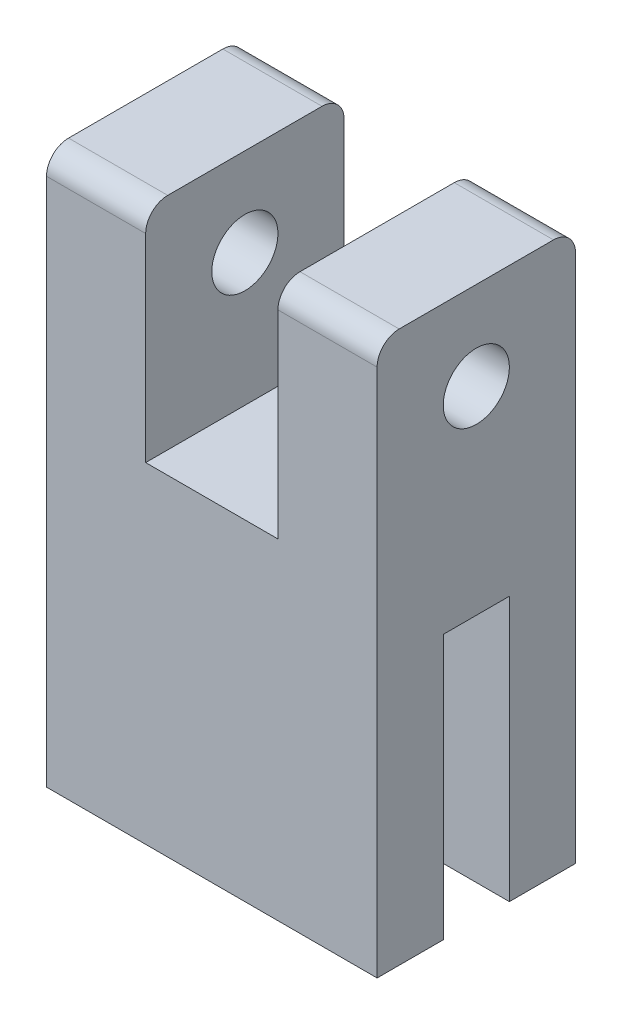
from build123d import *

# Parameters (mm, degrees)
CROQUIS2_W                 = 15
CROQUIS2_H                 = 15
SALIENTE_EXTRUIR1_DEPTH    = 4.5
CROQUIS3_W                 = 15
CROQUIS3_H                 = 12
CORTAR_EXTRUIR1_DEPTH      = 1.5
CORTAR_EXTRUIR2_DEPTH      = 12.521718622
CROQUIS10_W                = 4.5
CROQUIS10_H                = 9
SALIENTE_EXTRUIR4_DEPTH    = 10
CORTAR_EXTRUIR3_DEPTH      = 20.563997547
CORTAR_EXTRUIR3_DEPTH_BACK = 20.563997547
CROQUIS7_R                 = 1.5
REDONDEO2_R                = 1


with BuildPart() as part:
    # Croquis2 → Saliente-Extruir1 (new, symmetric)
    with BuildSketch(Plane.XY):
        Rectangle(CROQUIS2_W, CROQUIS2_H)
    extrude(amount=SALIENTE_EXTRUIR1_DEPTH, both=True)

    # Croquis3 → Cortar-Extruir1 (cut, symmetric)
    with BuildSketch(Plane.XY):
        with Locations((0, -1.5)):
            Rectangle(CROQUIS3_W, CROQUIS3_H)
    extrude(amount=CORTAR_EXTRUIR1_DEPTH, both=True, mode=Mode.SUBTRACT)

    # Croquis4 → Cortar-Extruir2 (cut, through all)
    with BuildSketch(Plane.XY):
        with BuildLine():
            Line((-1.5, 1), (-1.5, -7.5))
            Line((-1.5, -7.5), (1.5, -7.5))
            Line((1.5, -7.5), (1.5, 1))
            ThreePointArc((1.5, 1), (0, 2.5), (-1.5, 1))
        make_face()
    extrude(amount=-CORTAR_EXTRUIR2_DEPTH, mode=Mode.SUBTRACT)

    # Croquis10 → Saliente-Extruir4 (add)
    with BuildSketch(Plane(origin=(0, 7.5, 0), x_dir=(1, 0, 0), z_dir=(0, 1, 0))):
        with Locations((-5.25, 0)):
            Rectangle(CROQUIS10_W, CROQUIS10_H)
        with Locations((5.25, 0)):
            Rectangle(CROQUIS10_W, CROQUIS10_H)
    extrude(amount=SALIENTE_EXTRUIR4_DEPTH)

    # Croquis7 → Cortar-Extruir3 (cut, two sides: drawn at the far end of the back side and taken through both)
    with BuildSketch(Plane(origin=(0, 0, 0), x_dir=(0, 0, -1), z_dir=(1, 0, 0)).offset(-CORTAR_EXTRUIR3_DEPTH_BACK)):
        with Locations((0, 13.5)):
            Circle(CROQUIS7_R)
    extrude(amount=CORTAR_EXTRUIR3_DEPTH + CORTAR_EXTRUIR3_DEPTH_BACK, mode=Mode.SUBTRACT)

    # Redondeo2
    redondeo2_edges = [part.edges().sort_by_distance(p)[0] for p in [
        (5.25, 17.5, -4.5),
        (5.25, 17.5, 4.5),
        (-5.25, 17.5, 4.5),
        (-5.25, 17.5, -4.5),
    ]]
    fillet(redondeo2_edges, radius=REDONDEO2_R)


solid = part.part
